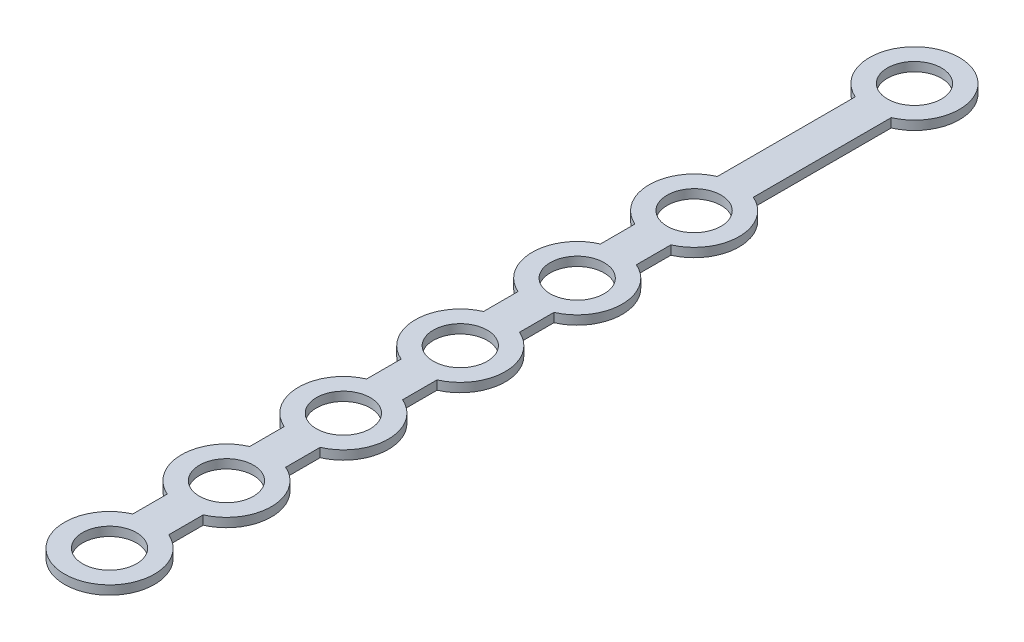
from build123d import *

# Parameters (mm, degrees)
SKETCH1_R             = 10
BASE_FLANGE1_DEPTH    = 2
SKETCH6_R             = 6
CUT_EXTRUDE1_DEPTH    = 15.282856857
SKETCH8_R             = 10
BASE_FLANGE2_DEPTH    = 2
SKETCH11_R            = 6
CUT_EXTRUDE2_DEPTH    = 38.416573868
SKETCH13_W            = 8
SKETCH13_H            = 3.83484861
TAB1_DEPTH            = 2
SKETCH16_W            = 8
SKETCH16_H            = 3.83484861
TAB2_DEPTH            = 2
SKETCH33_R            = 10
BOSS_EXTRUDE2_DEPTH   = 2
BOSS_EXTRUDE2_2_DEPTH = 2
BOSS_EXTRUDE2_3_DEPTH = 2
BOSS_EXTRUDE2_4_DEPTH = 2
BOSS_EXTRUDE2_5_DEPTH = 2
SKETCH23_W            = 8
SKETCH23_H            = 7.778071864
BOSS_EXTRUDE3_DEPTH   = 2
SKETCH41_R            = 6
CUT_EXTRUDE3_DEPTH    = 2


# Sheet-metal steps are written as plain solids
with BuildPart() as part:
    # Sketch1 → Base-Flange1 (new body)
    with BuildSketch(Plane(origin=(0, 0, 0), x_dir=(1, 0, 0), z_dir=(0, 1, 0))):
        with Locations(Location((0, 0, 0), (0, 0, 270))):
            Circle(SKETCH1_R)
    extrude(amount=-BASE_FLANGE1_DEPTH)

    # Sketch6 → Cut-Extrude1 (cut, through all)
    with BuildSketch(Plane(origin=(0, 0, 0), x_dir=(1, 0, 0), z_dir=(0, 1, 0))):
        with Locations(Location((0, 0, 0), (0, 0, 270))):
            Circle(SKETCH6_R)
    extrude(amount=-CUT_EXTRUDE1_DEPTH, mode=Mode.SUBTRACT)

    # Sketch13 → Tab1 (add)
    with BuildSketch(Plane(origin=(0, 0, 0), x_dir=(1, 0, 0), z_dir=(0, 1, 0))):
        with Locations((0, 11.082575695)):
            Rectangle(SKETCH13_W, SKETCH13_H)
    extrude(amount=-TAB1_DEPTH)



with BuildPart() as body_2:
    # Sketch8 → Base-Flange2 (new body)
    with BuildSketch(Plane(origin=(0, 0, 0), x_dir=(1, 0, 0), z_dir=(0, 1, 0))):
        with Locations(Location((0, 26, 0), (0, 0, 270))):
            Circle(SKETCH8_R)
    extrude(amount=-BASE_FLANGE2_DEPTH)

    # Sketch11 → Cut-Extrude2 (cut, through all)
    with BuildSketch(Plane(origin=(0, 0, 0), x_dir=(1, 0, 0), z_dir=(0, 1, 0))):
        with Locations(Location((0, 26, 0), (0, 0, 270))):
            Circle(SKETCH11_R)
    extrude(amount=-CUT_EXTRUDE2_DEPTH, mode=Mode.SUBTRACT)


with BuildPart() as part_1:
    add(part.part)

    add(body_2.part)  # Tab2 merges body 2
    # Sketch16 → Tab2 (add)
    with BuildSketch(Plane(origin=(0, 0, 0), x_dir=(1, 0, 0), z_dir=(0, 1, 0))):
        with Locations((0, 14.917424305)):
            Rectangle(SKETCH16_W, SKETCH16_H)
    extrude(amount=-TAB2_DEPTH)



with BuildPart() as body_2_2:
    # Sketch33 → Boss-Extrude2 (new body)
    with BuildSketch(Plane(origin=(0, 0, 0), x_dir=(1, 0, 0), z_dir=(0, 1, 0))):
        with Locations(Location((0, 52, 0), (0, 0, 270))):
            Circle(SKETCH33_R)
    extrude(amount=-BOSS_EXTRUDE2_DEPTH)


with BuildPart() as body_3:
    # Sketch33 → Boss-Extrude2 2 (new body)
    with BuildSketch(Plane(origin=(0, 0, 0), x_dir=(1, 0, 0), z_dir=(0, 1, 0))):
        with Locations(Location((0, 78, 0), (0, 0, 270))):
            Circle(SKETCH33_R)
    extrude(amount=-BOSS_EXTRUDE2_2_DEPTH)


with BuildPart() as body_4:
    # Sketch33 → Boss-Extrude2 3 (new body)
    with BuildSketch(Plane(origin=(0, 0, 0), x_dir=(1, 0, 0), z_dir=(0, 1, 0))):
        with Locations(Location((0, 104, 0), (0, 0, 270))):
            Circle(SKETCH33_R)
    extrude(amount=-BOSS_EXTRUDE2_3_DEPTH)


with BuildPart() as body_5:
    # Sketch33 → Boss-Extrude2 4 (new body)
    with BuildSketch(Plane(origin=(0, 0, 0), x_dir=(1, 0, 0), z_dir=(0, 1, 0))):
        with Locations(Location((0, 130, 0), (0, 0, 270))):
            Circle(SKETCH33_R)
    extrude(amount=-BOSS_EXTRUDE2_4_DEPTH)


with BuildPart() as body_6:
    # Sketch33 → Boss-Extrude2 5 (new body)
    with BuildSketch(Plane(origin=(0, 0, 0), x_dir=(1, 0, 0), z_dir=(0, 1, 0))):
        with Locations(Location((0, 179, 0), (0, 0, 270))):
            Circle(SKETCH33_R)
    extrude(amount=-BOSS_EXTRUDE2_5_DEPTH)


with BuildPart() as part_2:
    add(part_1.part)

    add(body_2_2.part)  # Boss-Extrude3 merges body 2 2

    add(body_3.part)  # Boss-Extrude3 merges body 3

    add(body_4.part)  # Boss-Extrude3 merges body 4

    add(body_5.part)  # Boss-Extrude3 merges body 5

    add(body_6.part)  # Boss-Extrude3 merges body 6
    # Sketch23 → Boss-Extrude3 (add)
    with BuildSketch(Plane(origin=(0, 0, 0), x_dir=(1, 0, 0), z_dir=(0, 1, 0))):
        with Locations((0, 39.054187322)):
            Rectangle(SKETCH23_W, SKETCH23_H)
        with Locations((0, 65.054187322)):
            Rectangle(SKETCH23_W, SKETCH23_H)
        with Locations((0, 91.054187322)):
            Rectangle(SKETCH23_W, SKETCH23_H)
        with Locations((0, 117.054187322)):
            Rectangle(SKETCH23_W, SKETCH23_H)
        Polygon((4, 139.16515139), (4, 146.943223254), (4, 160.16515139), (4, 169.043915681), (4, 173.041429596), (-4, 173.041429596), (-4, 169.043915681), (-4, 160.16515139), (-4, 146.943223254), (-4, 139.16515139), align=None)
    extrude(amount=-BOSS_EXTRUDE3_DEPTH)

    # Sketch41 → Cut-Extrude3 (cut)
    with BuildSketch(Plane(origin=(0, 0, 0), x_dir=(1, 0, 0), z_dir=(0, 1, 0))):
        with Locations(Location((0, 52, 0), (0, 0, 270))):
            Circle(SKETCH41_R)
        with Locations(Location((0, 78, 0), (0, 0, 270))):
            Circle(SKETCH41_R)
        with Locations(Location((0, 104, 0), (0, 0, 270))):
            Circle(SKETCH41_R)
        with Locations(Location((0, 130, 0), (0, 0, 270))):
            Circle(SKETCH41_R)
        with Locations(Location((0, 179, 0), (0, 0, 270))):
            Circle(SKETCH41_R)
    extrude(amount=-CUT_EXTRUDE3_DEPTH, mode=Mode.SUBTRACT)


solid = part_2.part
